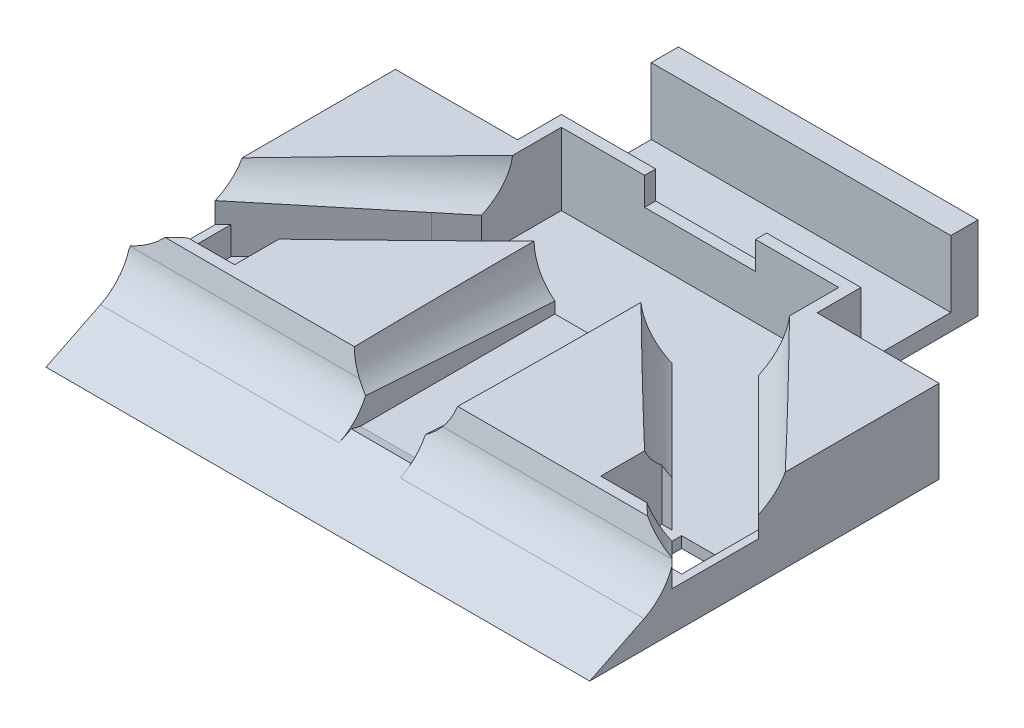
from build123d import *

# Parameters (mm, degrees)
SKETCH1_W                = 98
SKETCH1_H                = 90
BOSS_EXTRUDE1_DEPTH      = 15
CUT_EXTRUDE1_DEPTH       = 15
CUT_EXTRUDE2_DEPTH       = 15
CUT_EXTRUDE5_DEPTH       = 100
CUT_EXTRUDE6_DEPTH       = 100
SKETCH9_R                = 9.5
CUT_EXTRUDE7_DEPTH       = 45
SKETCH10_R               = 9.5
CUT_EXTRUDE8_DEPTH       = 45
BOSS_EXTRUDE3_DEPTH      = 100
BOSS_EXTRUDE4_DEPTH      = 100
SKETCH14_W               = 54.537944566
SKETCH14_H               = 37.433727788
CUT_EXTRUDE9_DEPTH       = 100
SKETCH15_W               = 37.221464136
SKETCH15_H               = 31.979004399
CUT_EXTRUDE10_DEPTH      = 100
BOSS_EXTRUDE5_DEPTH      = 15
BOSS_EXTRUDE6_DEPTH      = 15
BOSS_EXTRUDE7_DEPTH      = 15
CUT_EXTRUDE11_DEPTH      = 100
SKETCH20_R               = 9.5
CUT_EXTRUDE12_DEPTH      = 45
SKETCH21_R               = 9.5
CUT_EXTRUDE13_DEPTH      = 100
SKETCH22_R               = 9.5
BOSS_EXTRUDE8_DEPTH      = 55
SKETCH23_R               = 9.5
CUT_EXTRUDE14_DEPTH      = 55
SKETCH24_R               = 9.5
CUT_EXTRUDE15_DEPTH      = 100
SKETCH25_R               = 9.5
BOSS_EXTRUDE10_DEPTH     = 100
SKETCH26_R               = 9.5
CUT_EXTRUDE16_DEPTH      = 100
CUT_EXTRUDE19_DEPTH      = 100
CUT_EXTRUDE19_DEPTH_BACK = 100
SKETCH27_W               = 176.377882562
SKETCH27_H               = 122.842530298
SKETCH27_W_2             = 98
SKETCH27_H_2             = 90
SKETCH28_W               = 109.510814303
SKETCH28_H               = 24.111992001
CUT_EXTRUDE20_DEPTH      = 100
SKETCH29_R               = 9.59940523
CUT_EXTRUDE21_DEPTH      = 100
SKETCH30_W               = 22
SKETCH30_H               = 32
CUT_EXTRUDE22_DEPTH      = 100
SKETCH31_W               = 16.2
SKETCH31_H               = 12
CUT_EXTRUDE23_DEPTH      = 100
CUT_EXTRUDE24_DEPTH      = 13
SKETCH33_W               = 50.373016546
SKETCH33_H               = 2
BOSS_EXTRUDE12_DEPTH     = 15
SKETCH34_W               = 20
SKETCH34_H               = 2
CUT_EXTRUDE25_DEPTH      = 5
CUT_EXTRUDE27_DEPTH      = 100
SKETCH37_W               = 14
SKETCH37_H               = 11
CUT_EXTRUDE28_DEPTH      = 13
CUT_EXTRUDE32_DEPTH      = 9.5
CUT_EXTRUDE33_DEPTH      = 13
CUT_EXTRUDE34_DEPTH      = 13
BOSS_EXTRUDE18_DEPTH     = 5
BOSS_EXTRUDE19_DEPTH     = 5
BOSS_EXTRUDE21_DEPTH     = 98
BOSS_EXTRUDE22_DEPTH     = 98
BOSS_EXTRUDE23_DEPTH     = 98
SKETCH47_W               = 11
SKETCH47_H               = 1.433264646
CUT_EXTRUDE36_DEPTH      = 98
SKETCH48_W               = 11
SKETCH48_H               = 11
CUT_EXTRUDE37_DEPTH      = 98
BOSS_EXTRUDE24_DEPTH     = 5
BOSS_EXTRUDE25_DEPTH     = 5
FILLET1_R                = 10
SKETCH52_W               = 3
SKETCH52_H               = 15
CUT_EXTRUDE39_DEPTH      = 100


with BuildPart() as part:
    # Sketch1 → Boss-Extrude1 (new body)
    with BuildSketch(Plane(origin=(0, 0, 0), x_dir=(1, 0, 0), z_dir=(0, 1, 0))):
        with Locations((7.915679061, -25.165675541)):
            Rectangle(SKETCH1_W, SKETCH1_H)
    extrude(amount=BOSS_EXTRUDE1_DEPTH)

    # Sketch3 → Cut-Extrude1 (cut)
    with BuildSketch(Plane(origin=(0, 15, 0), x_dir=(1, 0, 0), z_dir=(0, 1, 0))):
        Polygon((-41.084320939, -35.165675541), (-6.084320939, -70.165675541), (-41.084320939, -70.165675541), align=None)
        Polygon((21.915679061, -70.165675541), (56.915679061, -35.165675541), (56.915679061, -70.165675541), align=None)
    extrude(amount=-CUT_EXTRUDE1_DEPTH, mode=Mode.SUBTRACT)

    # Sketch4 → Cut-Extrude2 (cut)
    with BuildSketch(Plane(origin=(0, 15, 0), x_dir=(1, 0, 0), z_dir=(0, 1, 0))):
        Polygon((-41.084320939, -35.165675541), (-32.241899351, -26.323253953), (-41.084320939, -17.480832365), align=None)
        Polygon((56.915679061, -17.480832365), (48.073257473, -26.323253953), (56.915679061, -35.165675541), align=None)
    extrude(amount=-CUT_EXTRUDE2_DEPTH, mode=Mode.SUBTRACT)

    # Sketch5 → Cut-Extrude5 (cut)
    with BuildSketch(Plane(origin=(-2.959322699, 0, -2.959322699), x_dir=(-0.7071067811865461, 0, 0.7071067811865489), z_dir=(-0.7071067811865489, 0, -0.7071067811865461))):
        Polygon((53.916889577, 0), (52.916889577, 15), (53.916889577, 15), align=None)
    extrude(amount=-CUT_EXTRUDE5_DEPTH, mode=Mode.SUBTRACT)

    # Sketch8 → Cut-Extrude6 (cut)
    with BuildSketch(Plane(origin=(10.87500176, 0, -10.87500176), x_dir=(-0.7071067811865438, 0, -0.7071067811865513), z_dir=(0.7071067811865513, 0, -0.7071067811865438))):
        Polygon((-65.11135026, 0), (-64.11135026, 15), (-65.11135026, 15), align=None)
    extrude(amount=-CUT_EXTRUDE6_DEPTH, mode=Mode.SUBTRACT)

    # Sketch9 → Cut-Extrude7 (cut)
    with BuildSketch(Plane(origin=(45.83695749, 4.321549796, 45.83695749), x_dir=(0.7086694500121591, -0.06622532692378834, -0.7024256663116043), z_dir=(0.7055406512876944, 0.06651901052377404, 0.7055406512877016))):
        with Locations((-0.364665022, 13.674807707)):
            Circle(SKETCH9_R)
    extrude(amount=-CUT_EXTRUDE7_DEPTH, mode=Mode.SUBTRACT)

    # Sketch10 → Cut-Extrude8 (cut)
    with BuildSketch(Plane(origin=(-37.956303558, 3.578554618, 37.956303558), x_dir=(0.708669450012157, 0.06622532692378813, 0.7024256663116066), z_dir=(-0.7055406512876966, 0.06651901052377338, 0.7055406512876994))):
        with Locations((11.452044949, 13.683576238)):
            Circle(SKETCH10_R)
    extrude(amount=-CUT_EXTRUDE8_DEPTH, mode=Mode.SUBTRACT)

    # Sketch12 → Boss-Extrude3 (add)
    with BuildSketch(Plane(origin=(10.87500176, 0, -10.87500176), x_dir=(-0.7071067811865438, 0, -0.7071067811865513), z_dir=(0.7071067811865513, 0, -0.7071067811865438))):
        Polygon((-65.11135026, 0), (-64.11135026, 15), (-65.11135026, 15), align=None)
    extrude(amount=-BOSS_EXTRUDE3_DEPTH)

    # Sketch13 → Boss-Extrude4 (add)
    with BuildSketch(Plane(origin=(-2.959322699, 0, -2.959322699), x_dir=(-0.7071067811865461, 0, 0.7071067811865489), z_dir=(-0.7071067811865489, 0, -0.7071067811865461))):
        Polygon((53.916889577, 0), (52.916889577, 15), (53.916889577, 15), align=None)
    extrude(amount=-BOSS_EXTRUDE4_DEPTH)

    # Sketch14 → Cut-Extrude9 (cut)
    with BuildSketch(Plane(origin=(0, 15, 0), x_dir=(1, 0, 0), z_dir=(0, 1, 0))):
        with Locations((21.184651344, -88.882539435)):
            Rectangle(SKETCH14_W, SKETCH14_H)
    extrude(amount=-CUT_EXTRUDE9_DEPTH, mode=Mode.SUBTRACT)


with BuildPart() as cut_extrude9_piece_1:
    # of the separate pieces the step leaves, piece 1, a body of its own (cut_extrude9_pieces)
    add(part.part.solids().sort_by_distance((-41.084320939, 0, -19.834324459))[0])

    # Sketch16 → Boss-Extrude5 (add)
    with BuildSketch(Plane(origin=(0, 15, 0), x_dir=(1, 0, 0), z_dir=(0, 1, 0))):
        Polygon((-6.084320939, -70.165675541), (-35.8985557, -70.165675541), (-41.084320939, -70.165675541), (-41.084320939, -35.165675541), align=None)
    extrude(amount=-BOSS_EXTRUDE5_DEPTH)

    # Sketch17 → Boss-Extrude6 (add)
    with BuildSketch(Plane(origin=(0, 15, 0), x_dir=(1, 0, 0), z_dir=(0, 1, 0))):
        Polygon((21.915679061, -70.165675541), (49.886241171, -70.165675541), (56.915679061, -70.165675541), (56.915679061, -35.165675541), align=None)
    extrude(amount=-BOSS_EXTRUDE6_DEPTH)

    # Sketch18 → Boss-Extrude7 (add)
    with BuildSketch(Plane(origin=(0, 15, 0), x_dir=(1, 0, 0), z_dir=(0, 1, 0))):
        Polygon((48.073257473, -26.323253953), (56.915679061, -17.480832365), (56.915679061, -35.165675541), align=None)
        Polygon((-41.084320939, -35.165675541), (-41.084320939, -17.480832365), (-32.241899351, -26.323253953), align=None)
    extrude(amount=-BOSS_EXTRUDE7_DEPTH)

    # Sketch19 → Cut-Extrude11 (cut)
    with BuildSketch(Plane(origin=(56.915679061, 0, 0), x_dir=(0, 0, -1), z_dir=(1, 0, 0))):
        Polygon((-70.165675541, 0), (-69.165675541, 15), (-70.165675541, 15), align=None)
    extrude(amount=-CUT_EXTRUDE11_DEPTH, mode=Mode.SUBTRACT)

    # Sketch20 → Cut-Extrude12 (cut)
    with BuildSketch(Plane(origin=(0, 4.657013863, 69.85520795), x_dir=(1, 0, 0), z_dir=(0, 0.06651901052377399, 0.997785157856609))):
        with Locations((7.915679061, 13.33264869)):
            Circle(SKETCH20_R)
    extrude(amount=-CUT_EXTRUDE12_DEPTH, mode=Mode.SUBTRACT)

    # Sketch21 → Cut-Extrude13 (cut)
    with BuildSketch(Plane(origin=(14.087628182, 1.328194322, 14.087628182), x_dir=(0.708669450012159, -0.06622532692378837, -0.7024256663116044), z_dir=(0.7055406512876945, 0.06651901052377404, 0.7055406512877015))):
        with Locations((2.201455665, 13.878873478)):
            Circle(SKETCH21_R)
    extrude(amount=CUT_EXTRUDE13_DEPTH, mode=Mode.SUBTRACT)

    # Sketch22 → Boss-Extrude8 (add)
    with BuildSketch(Plane(origin=(14.087628182, 1.328194322, 14.087628182), x_dir=(0.708669450012159, -0.06622532692378837, -0.7024256663116044), z_dir=(0.7055406512876945, 0.06651901052377404, 0.7055406512877015))):
        with Locations((-0.364665022, 13.674807707)):
            Circle(SKETCH22_R)
    extrude(amount=BOSS_EXTRUDE8_DEPTH)

    # Sketch23 → Cut-Extrude14 (cut)
    with BuildSketch(Plane(origin=(52.892364003, 4.986739901, 52.892364003), x_dir=(0.7024256663116113, 0.0662253269237897, -0.7086694500121521), z_dir=(0.7055406512876945, 0.06651901052377404, 0.7055406512877014))):
        with Locations((4.020343442, 13.465005557)):
            Circle(SKETCH23_R)
    extrude(amount=-CUT_EXTRUDE14_DEPTH, mode=Mode.SUBTRACT)

    # Sketch24 → Cut-Extrude15 (cut)
    with BuildSketch(Plane(origin=(-6.20697425, 0.585199144, 6.20697425), x_dir=(0.708669450012157, 0.06622532692378813, 0.7024256663116066), z_dir=(-0.7055406512876966, 0.06651901052377338, 0.7055406512876995))):
        with Locations((8.951834225, 13.883257743)):
            Circle(SKETCH24_R)
    extrude(amount=CUT_EXTRUDE15_DEPTH, mode=Mode.SUBTRACT)

    # Sketch25 → Boss-Extrude10 (add)
    with BuildSketch(Plane(origin=(-6.20697425, 0.585199144, 6.20697425), x_dir=(0.708669450012157, 0.06622532692378813, 0.7024256663116066), z_dir=(-0.7055406512876966, 0.06651901052377338, 0.7055406512876994))):
        with Locations(Location((11.452044949, 13.683576238, 0), (0, 0, 175.993532534))):
            Circle(SKETCH25_R)
    extrude(amount=BOSS_EXTRUDE10_DEPTH)

    # Sketch26 → Cut-Extrude16 (cut)
    with BuildSketch(Plane(origin=(-6.20697425, 0.585199144, 6.20697425), x_dir=(0.708669450012157, 0.06622532692378813, 0.7024256663116066), z_dir=(-0.7055406512876966, 0.06651901052377338, 0.7055406512876994))):
        with Locations((8.951834225, 13.883257743)):
            Circle(SKETCH26_R)
    extrude(amount=CUT_EXTRUDE16_DEPTH, mode=Mode.SUBTRACT)

    # Sketch27 → Cut-Extrude19 (cut, two sides: drawn at the far end of the back side and taken through both)
    with BuildSketch(Plane(origin=(0, 15, 0), x_dir=(1, 0, 0), z_dir=(0, 1, 0)).offset(-CUT_EXTRUDE19_DEPTH_BACK)):
        with Locations((3.867081439, -38.319377922)):
            Rectangle(SKETCH27_W, SKETCH27_H)
        with Locations((7.915679061, -25.165675541)):
            Rectangle(SKETCH27_W_2, SKETCH27_H_2, mode=Mode.SUBTRACT)
    extrude(amount=CUT_EXTRUDE19_DEPTH + CUT_EXTRUDE19_DEPTH_BACK, mode=Mode.SUBTRACT)

    # Sketch28 → Cut-Extrude20 (cut)
    with BuildSketch(Plane(origin=(0, 0, -19.834324459), x_dir=(-1, 0, 0), z_dir=(0, 0, -1))):
        with Locations((-2.16027191, 27.055996001)):
            Rectangle(SKETCH28_W, SKETCH28_H)
    extrude(amount=-CUT_EXTRUDE20_DEPTH, mode=Mode.SUBTRACT)

    # Sketch29 → Cut-Extrude21 (cut)
    with BuildSketch(Plane(origin=(0, 1.66365839, 24.954875847), x_dir=(1, 0, 0), z_dir=(0, 0.066519010523774, 0.997785157856609))):
        with Locations((7.822016096, 13.365945069)):
            Circle(SKETCH29_R)
    extrude(amount=CUT_EXTRUDE21_DEPTH, mode=Mode.SUBTRACT)

    # Sketch30 → Cut-Extrude22 (cut)
    with BuildSketch(Plane(origin=(0, 15, 0), x_dir=(1, 0, 0), z_dir=(0, 1, 0))):
        with Locations((-30.084320939, 3.834324459)):
            Rectangle(SKETCH30_W, SKETCH30_H)
        with Locations((45.915679061, 3.834324459)):
            Rectangle(SKETCH30_W, SKETCH30_H)
    extrude(amount=-CUT_EXTRUDE22_DEPTH, mode=Mode.SUBTRACT)

    # Sketch31 → Cut-Extrude23 (cut)
    with BuildSketch(Plane(origin=(34.915679061, 0, 0), x_dir=(0, 0, -1), z_dir=(1, 0, 0))):
        with Locations((3.834324459, 9)):
            Rectangle(SKETCH31_W, SKETCH31_H)
    extrude(amount=-CUT_EXTRUDE23_DEPTH, mode=Mode.SUBTRACT)

    # Sketch32 → Cut-Extrude24 (cut)
    with BuildSketch(Plane(origin=(0, 15, 0), x_dir=(1, 0, 0), z_dir=(0, 1, 0))):
        Polygon((-1.776033561, -26.490930679), (32.915679061, -26.490930679), (32.915679061, -6.265675541), (-1.776033561, -6.265675541), (-17.084320939, -6.265675541), (-17.084320939, -26.490930679), align=None)
    extrude(amount=-CUT_EXTRUDE24_DEPTH, mode=Mode.SUBTRACT)

    # Sketch33 → Boss-Extrude12 (add)
    with BuildSketch(Plane(origin=(0, 15, 0), x_dir=(1, 0, 0), z_dir=(0, 1, 0))):
        with Locations((7.729170788, -5.265675541)):
            Rectangle(SKETCH33_W, SKETCH33_H)
    extrude(amount=-BOSS_EXTRUDE12_DEPTH)

    # Sketch34 → Cut-Extrude25 (cut)
    with BuildSketch(Plane(origin=(0, 15, 0), x_dir=(1, 0, 0), z_dir=(0, 1, 0))):
        with Locations((7.915679061, -5.265675541)):
            Rectangle(SKETCH34_W, SKETCH34_H)
    extrude(amount=-CUT_EXTRUDE25_DEPTH, mode=Mode.SUBTRACT)

    # Sketch35 → Cut-Extrude27 (cut)
    with BuildSketch(Plane(origin=(56.915679061, 0, 0), x_dir=(0, 0, -1), z_dir=(1, 0, 0))):
        Polygon((-70.165675541, 0), (-62.165675541, 3), (-59.165675541, 15), (-69.165675541, 15), align=None)
    extrude(amount=-CUT_EXTRUDE27_DEPTH, mode=Mode.SUBTRACT)

    # Sketch37 → Cut-Extrude28 (cut)
    with BuildSketch(Plane(origin=(0, 15, 0), x_dir=(1, 0, 0), z_dir=(0, 1, 0))):
        with Locations((-32.084320939, -51.665675541)):
            Rectangle(SKETCH37_W, SKETCH37_H)
        with Locations((47.915679061, -51.665675541)):
            Rectangle(SKETCH37_W, SKETCH37_H)
    extrude(amount=-CUT_EXTRUDE28_DEPTH, mode=Mode.SUBTRACT)

    # Sketch38 → Cut-Extrude32 (cut)
    with BuildSketch(Plane(origin=(0, 15, 0), x_dir=(1, 0, 0), z_dir=(0, 1, 0))):
        Polygon((1.978443982, -26.490930679), (12.978443982, -26.490930679), (12.978443982, -60.585728785), (12.978443982, -67.440751443), (1.978443982, -67.440751443), (1.978443982, -60.585728785), align=None)
    extrude(amount=-CUT_EXTRUDE32_DEPTH, mode=Mode.SUBTRACT)

    # Sketch39 → Cut-Extrude33 (cut)
    with BuildSketch(Plane(origin=(0, 15, 0), x_dir=(1, 0, 0), z_dir=(0, 1, 0))):
        Polygon((-45.219574639, -64.32279028), (-13.788468286, -32.935894494), (-3.89606958, -23.043495788), (-11.674242247, -15.265323121), (-21.561166767, -25.152247641), (-52.99227312, -56.539143427), align=None)
    extrude(amount=-CUT_EXTRUDE33_DEPTH, mode=Mode.SUBTRACT)

    # Sketch40 → Cut-Extrude34 (cut)
    with BuildSketch(Plane(origin=(0, 15, 0), x_dir=(1, 0, 0), z_dir=(0, 1, 0))):
        Polygon((61.02716679, -64.431216155), (18.755523073, -22.159572438), (26.533697666, -14.381397845), (68.805341383, -56.653041562), align=None)
    extrude(amount=-CUT_EXTRUDE34_DEPTH, mode=Mode.SUBTRACT)

    # Sketch41 → Boss-Extrude18 (add)
    with BuildSketch(Plane(origin=(0, 2, 0), x_dir=(1, 0, 0), z_dir=(0, 1, 0))):
        Polygon((56.915679061, -60.319728426), (56.915679061, -44.76337924), (55.501465498, -43.349165677), (55.501465498, -58.905514864), align=None)
    extrude(amount=BOSS_EXTRUDE18_DEPTH)

    # Sketch42 → Boss-Extrude19 (add)
    with BuildSketch(Plane(origin=(0, 2, 0), x_dir=(1, 0, 0), z_dir=(0, 1, 0))):
        Polygon((-41.084320939, -44.64794081), (-39.669112421, -43.234722905), (-39.669112421, -58.780135266), (-41.084320939, -60.193353172), align=None)
    extrude(amount=BOSS_EXTRUDE19_DEPTH)

    # Sketch43 → Boss-Extrude21 (add)
    with BuildSketch(Plane(origin=(56.915679061, 0, 0), x_dir=(0, 0, -1), z_dir=(1, 0, 0))):
        Polygon((-62.165675541, 3), (-75.154441573, 0), (-62.154441573, 0), align=None)
    extrude(amount=-BOSS_EXTRUDE21_DEPTH)

    # Sketch45 → Boss-Extrude22 (add)
    with BuildSketch(Plane(origin=(56.915679061, 0, 0), x_dir=(0, 0, -1), z_dir=(1, 0, 0))):
        Polygon((-75.154441573, 0), (-61.544684912, 5.483962515), (-62.165675541, 3), align=None)
    extrude(amount=-BOSS_EXTRUDE22_DEPTH)

    # Sketch46 → Boss-Extrude23 (add)
    with BuildSketch(Plane(origin=(56.915679061, 0, 0), x_dir=(0, 0, -1), z_dir=(1, 0, 0))):
        Polygon((-75.154441573, 0), (-61.193057804, 6.890470947), (-61.544684912, 5.483962515), align=None)
    extrude(amount=-BOSS_EXTRUDE23_DEPTH)

    # Sketch47 → Cut-Extrude36 (cut)
    with BuildSketch(Plane(origin=(0, 14.803688363, 59.21475345), x_dir=(-1, 0, 0), z_dir=(0, -0.24253562503633455, -0.9701425001453315))):
        with Locations((-7.478443982, -8.873390134)):
            Rectangle(SKETCH47_W, SKETCH47_H)
    extrude(amount=-CUT_EXTRUDE36_DEPTH, mode=Mode.SUBTRACT)

    # Sketch48 → Cut-Extrude37 (cut)
    with BuildSketch(Plane(origin=(0, 2, 0), x_dir=(1, 0, 0), z_dir=(0, 1, 0))):
        with Locations((50.001465498, -51.665675541)):
            Rectangle(SKETCH48_W, SKETCH48_H)
        with Locations((-34.169112421, -51.665675541)):
            Rectangle(SKETCH48_W, SKETCH48_H)
    extrude(amount=-CUT_EXTRUDE37_DEPTH, mode=Mode.SUBTRACT)

    # Sketch49 → Boss-Extrude24 (add)
    with BuildSketch(Plane(origin=(0, 2, 0), x_dir=(1, 0, 0), z_dir=(0, 1, 0))):
        Polygon((55.501465498, -58.905514864), (53.761626176, -57.165675541), (55.501465498, -57.165675541), align=None)
    extrude(amount=BOSS_EXTRUDE24_DEPTH)

    # Sketch50 → Boss-Extrude25 (add)
    with BuildSketch(Plane(origin=(0, 2, 0), x_dir=(1, 0, 0), z_dir=(0, 1, 0))):
        Polygon((-39.669112421, -58.780135266), (-39.669112421, -57.165675541), (-38.05237862, -57.165675541), align=None)
    extrude(amount=BOSS_EXTRUDE25_DEPTH)

    # Fillet1
    # the kernel refuses this fillet: 10 mm, written as the material it adds along each edge
    with BuildSketch(Plane(origin=(13.55540496, 6.890470947, 61.193057804), x_dir=(0, 0.9701425001453308, -0.24253562503633758), z_dir=(-1, 0, 0))) as fillet1_piece_1_section:
        with BuildLine():
            CenterArc((FILLET1_R * 0.463078439096, -FILLET1_R), FILLET1_R, 90, 49.695674719)
            Line((-FILLET1_R * 0.299541062007, -FILLET1_R * 0.353152648194), (0, 0))
            Line((0, 0), (FILLET1_R * 0.463078439096, 0))
        make_face()
    fillet1_piece_1 = extrude(amount=66.216686876, mode=Mode.PRIVATE)
    fillet1_piece_1 = fillet1_piece_1 - Plane(origin=(7.822016096, 17.466268035, 61.059806924), x_dir=(1, 0, 0), z_dir=(0, -0.066519010523774, -0.997785157856609)) * Cylinder(9.59940523, 151, mode=Mode.PRIVATE)
    fillet1_piece_1 = split(fillet1_piece_1, bisect_by=Plane(origin=(12.978443982, 7.402731352, 61.73070937), z_dir=(1, 0, 0)), keep=Keep.TOP, mode=Mode.PRIVATE)
    add(fillet1_piece_1)
    with BuildSketch(Plane(origin=(1.978443982, 6.890470947, 61.193057804), x_dir=(0, 0.9701425001453315, -0.24253562503633466), z_dir=(-1, 0, 0))) as fillet1_piece_2_section:
        with BuildLine():
            CenterArc((FILLET1_R * 0.463078439096, -FILLET1_R), FILLET1_R, 90, 49.695674719)
            Line((-FILLET1_R * 0.299541062007, -FILLET1_R * 0.353152648194), (0, 0))
            Line((0, 0), (FILLET1_R * 0.463078439096, 0))
        make_face()
    fillet1_piece_2 = extrude(amount=43.062764921, mode=Mode.PRIVATE)
    fillet1_piece_2 = fillet1_piece_2 - Plane(origin=(7.822016096, 17.463039168, 61.011373922), x_dir=(1, 0, 0), z_dir=(0, -0.066519010523774, -0.997785157856609)) * Cylinder(9.59940523, 105, mode=Mode.PRIVATE)
    fillet1_piece_2 = split(fillet1_piece_2, bisect_by=Plane(origin=(-31.047137457, 7.518724185, 50.170287855), z_dir=(0.7066089528007494, 0, 0.7076042593299086)), keep=Keep.TOP, mode=Mode.PRIVATE)
    add(fillet1_piece_2)
    with BuildSketch(Plane(origin=(56.915679061, 6.890470947, 61.193057804), x_dir=(0, 0.9701425001453315, -0.24253562503633466), z_dir=(-1, 0, 0))) as fillet1_piece_3_section:
        with BuildLine():
            CenterArc((FILLET1_R * 0.463078439096, -FILLET1_R), FILLET1_R, 90, 49.695674719)
            Line((-FILLET1_R * 0.299541062007, -FILLET1_R * 0.353152648194), (0, 0))
            Line((0, 0), (FILLET1_R * 0.463078439096, 0))
        make_face()
    fillet1_piece_3 = extrude(amount=43.937235079, mode=Mode.PRIVATE)
    fillet1_piece_3 = fillet1_piece_3 - Plane(origin=(7.822016096, 17.463085429, 61.012067836), x_dir=(1, 0, 0), z_dir=(0, -0.066519010523774, -0.997785157856609)) * Cylinder(9.59940523, 107, mode=Mode.PRIVATE)
    fillet1_piece_3 = split(fillet1_piece_3, bisect_by=Plane(origin=(46.619372597, 7.517054753, 50.023421962), z_dir=(-0.7071067811865472, 0, 0.7071067811865478)), keep=Keep.TOP, mode=Mode.PRIVATE)
    add(fillet1_piece_3)
    with BuildSketch(Plane(origin=(68.492640038, 6.890470947, 61.193057804), x_dir=(0, 0.9701425001453315, -0.2425356250363346), z_dir=(-1, 0, 0))) as fillet1_piece_4_section:
        with BuildLine():
            CenterArc((FILLET1_R * 0.463078439096, -FILLET1_R), FILLET1_R, 90, 49.695674719)
            Line((-FILLET1_R * 0.299541062007, -FILLET1_R * 0.353152648194), (0, 0))
            Line((0, 0), (FILLET1_R * 0.463078439096, 0))
        make_face()
    fillet1_piece_4 = extrude(amount=67.091157033, mode=Mode.PRIVATE)
    fillet1_piece_4 = fillet1_piece_4 - Plane(origin=(7.822016096, 17.464349007, 61.031021503), x_dir=(1, 0, 0), z_dir=(0, -0.066519010523774, -0.997785157856609)) * Cylinder(9.59940523, 153, mode=Mode.PRIVATE)
    fillet1_piece_4 = split(fillet1_piece_4, bisect_by=Plane(origin=(1.978443982, 7.469174188, 61.697366491), z_dir=(-1, 0, 0)), keep=Keep.TOP, mode=Mode.PRIVATE)
    add(fillet1_piece_4)

    # Sketch52 → Cut-Extrude39 (cut)
    with BuildSketch(Plane(origin=(34.915679061, 0, 0), x_dir=(0, 0, -1), z_dir=(1, 0, 0))):
        with Locations((18.334324459, 7.5)):
            Rectangle(SKETCH52_W, SKETCH52_H)
    extrude(amount=-CUT_EXTRUDE39_DEPTH, mode=Mode.SUBTRACT)


with BuildPart() as cut_extrude9_piece_2:
    # of the separate pieces the step leaves, piece 2, a body of its own (cut_extrude9_pieces)
    add(part.part.solids().sort_by_distance((-6.084320939, 15, 96.751461979))[0])

    # Sketch15 → Cut-Extrude10 (cut)
    with BuildSketch(Plane(origin=(0, 15, 0), x_dir=(1, 0, 0), z_dir=(0, 1, 0))):
        with Locations((-15.067513526, -92.658393077)):
            Rectangle(SKETCH15_W, SKETCH15_H)
    extrude(amount=-CUT_EXTRUDE10_DEPTH, mode=Mode.SUBTRACT)


solid = cut_extrude9_piece_1.part
